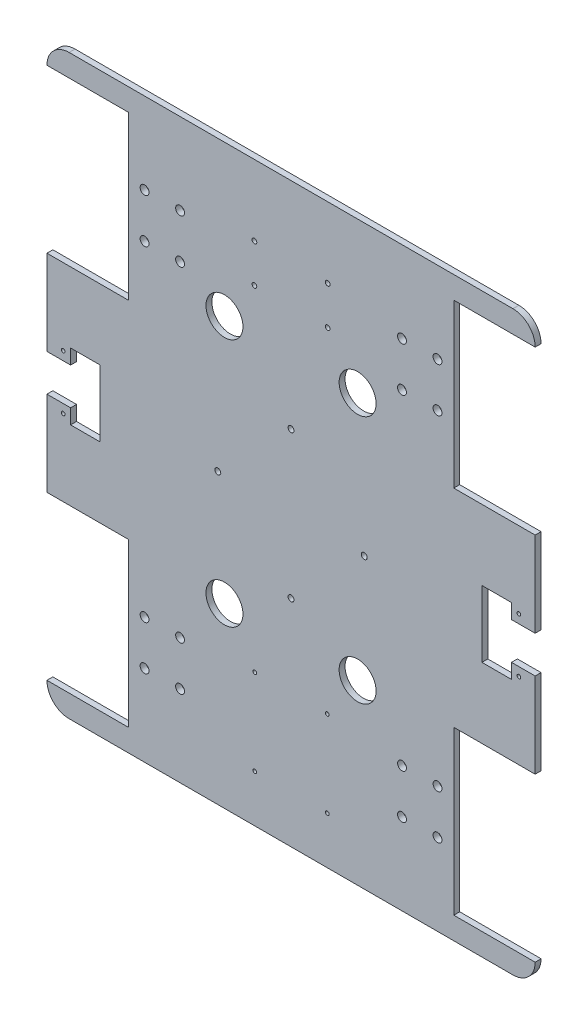
from build123d import *

# Parameters (mm, degrees)
SKETCH_1_W          = 330
SKETCH_1_H          = 390
EXTRUDE_1_DEPTH     = 4
SKETCH_3_W          = 110
SKETCH_3_H          = 110
CUT_EXTRUDE_1_DEPTH = 4
SKETCH_5_R          = 1.25
CUT_EXTRUDE_2_DEPTH = 4
SKETCH_7_R          = 2
CUT_EXTRUDE_3_DEPTH = 4
SKETCH_8_R          = 1.6
CUT_EXTRUDE_4_DEPTH = 4
SKETCH_9_R          = 3
CUT_EXTRUDE_5_DEPTH = 4
SKETCH_11_R         = 3
CUT_EXTRUDE_6_DEPTH = 4
SKETCH_14_R         = 12.5
CUT_EXTRUDE_7_DEPTH = 4
FILLET_1_R          = 15
SKETCH_15_R         = 1.25
CUT_EXTRUDE_8_DEPTH = 4
CUT_EXTRUDE_9_DEPTH = 4


with BuildPart() as part:
    # 草图1 → 凸台-拉伸1 (new body)
    with BuildSketch(Plane.XY):
        Rectangle(SKETCH_1_W, SKETCH_1_H)
    extrude(amount=EXTRUDE_1_DEPTH)

    # 草图3 → 切除-拉伸1 (cut)
    with BuildSketch(Plane.XY.offset(4)):
        with Locations((165, 125)):
            Rectangle(SKETCH_3_W, SKETCH_3_H)
        with Locations((165, -125)):
            Rectangle(SKETCH_3_W, SKETCH_3_H)
        with Locations((-165, -125)):
            Rectangle(SKETCH_3_W, SKETCH_3_H)
        with Locations((-165, 125)):
            Rectangle(SKETCH_3_W, SKETCH_3_H)
    extrude(amount=-CUT_EXTRUDE_1_DEPTH, mode=Mode.SUBTRACT)

    # 草图5 → 切除-拉伸2 (cut)
    with BuildSketch(Plane.XY.offset(4)):
        with Locations((24.5, -163)):
            Circle(SKETCH_5_R)
        with Locations((24.5, -105)):
            Circle(SKETCH_5_R)
        with Locations(Location((-24.5, -105, 0), (0, 0, 180))):
            Circle(SKETCH_5_R)
        with Locations(Location((-24.5, -163, 0), (0, 0, 180))):
            Circle(SKETCH_5_R)
    extrude(amount=-CUT_EXTRUDE_2_DEPTH, mode=Mode.SUBTRACT)

    # 草图7 → 切除-拉伸3 (cut)
    with BuildSketch(Plane.XY.offset(4)):
        with Locations((49.493881146, 0)):
            Circle(SKETCH_7_R)
        with Locations((-49.501067959, 0.007186813)):
            Circle(SKETCH_7_R)
        with Locations((0, 49.501067959)):
            Circle(SKETCH_7_R)
        with Locations((-0.007186813, -49.493881146)):
            Circle(SKETCH_7_R)
    extrude(amount=-CUT_EXTRUDE_3_DEPTH, mode=Mode.SUBTRACT)

    # 草图8 → 切除-拉伸4 (cut)
    with BuildSketch(Plane.XY.offset(4)):
        with Locations((24.75, 121.25952533)):
            Circle(SKETCH_8_R)
        with Locations((24.75, 147.25952533)):
            Circle(SKETCH_8_R)
        with Locations(Location((-24.75, 147.25952533, 0), (0, 0, 180))):
            Circle(SKETCH_8_R)
        with Locations(Location((-24.75, 121.25952533, 0), (0, 0, 180))):
            Circle(SKETCH_8_R)
    extrude(amount=-CUT_EXTRUDE_4_DEPTH, mode=Mode.SUBTRACT)

    # 草图9 → 切除-拉伸5 (cut)
    with BuildSketch(Plane.XY.offset(4)):
        with Locations((99, -140)):
            Circle(SKETCH_9_R)
        with Locations((75, -140)):
            Circle(SKETCH_9_R)
        with Locations(Location((99, -110, 0), (0, 0, 180))):
            Circle(SKETCH_9_R)
        with Locations(Location((75, -110, 0), (0, 0, 180))):
            Circle(SKETCH_9_R)
        with Locations((-99, -110)):
            Circle(SKETCH_9_R)
        with Locations((-75, -110)):
            Circle(SKETCH_9_R)
        with Locations(Location((-99, -140, 0), (0, 0, 180))):
            Circle(SKETCH_9_R)
        with Locations(Location((-75, -140, 0), (0, 0, 180))):
            Circle(SKETCH_9_R)
    extrude(amount=-CUT_EXTRUDE_5_DEPTH, mode=Mode.SUBTRACT)

    # 草图11 → 切除-拉伸6 (cut)
    with BuildSketch(Plane.XY.offset(4)):
        with Locations((99, 140)):
            Circle(SKETCH_11_R)
        with Locations((99, 110)):
            Circle(SKETCH_11_R)
        with Locations((75, 110)):
            Circle(SKETCH_11_R)
        with Locations((75, 140)):
            Circle(SKETCH_11_R)
        with Locations(Location((-75, 110, 0), (0, 0, 180))):
            Circle(SKETCH_11_R)
        with Locations(Location((-99, 110, 0), (0, 0, 180))):
            Circle(SKETCH_11_R)
        with Locations(Location((-99, 140, 0), (0, 0, 180))):
            Circle(SKETCH_11_R)
        with Locations(Location((-75, 140, 0), (0, 0, 180))):
            Circle(SKETCH_11_R)
    extrude(amount=-CUT_EXTRUDE_6_DEPTH, mode=Mode.SUBTRACT)

    # 草图14 → 切除-拉伸7 (cut)
    with BuildSketch(Plane.XY.offset(4)):
        with Locations((45, 93.171201499)):
            Circle(SKETCH_14_R)
        with Locations((45, -75.052125949)):
            Circle(SKETCH_14_R)
        with Locations(Location((-45, -75.052125949, 0), (0, 0, 180))):
            Circle(SKETCH_14_R)
        with Locations(Location((-45, 93.171201499, 0), (0, 0, 180))):
            Circle(SKETCH_14_R)
    extrude(amount=-CUT_EXTRUDE_7_DEPTH, mode=Mode.SUBTRACT)

    # 圆角1
    fillet_1_edges = [part.edges().sort_by_distance(p)[0] for p in [
        (165, -195, 2),
        (-165, -195, 2),
        (165, 195, 2),
        (-165, 195, 2),
    ]]
    fillet(fillet_1_edges, radius=FILLET_1_R - 0.0001)  # a hair under: the kernel refuses the full size

    # 草图15 → 切除-拉伸8 (cut)
    with BuildSketch(Plane.XY.offset(4)):
        with Locations((154, 18.45)):
            Circle(SKETCH_15_R)
        with Locations((154, -18.342402047)):
            Circle(SKETCH_15_R)
    cut_extrude_8 = extrude(amount=-CUT_EXTRUDE_8_DEPTH, mode=Mode.SUBTRACT)

    # 草图16 → 切除-拉伸9 (cut)
    with BuildSketch(Plane.XY.offset(4)):
        Polygon((165, -12.5), (165, 12.5), (149, 12.5), (149, 22.5), (129, 22.5), (129, -22.5), (149, -22.5), (149, -12.5), align=None)
    cut_extrude_9 = extrude(amount=-CUT_EXTRUDE_9_DEPTH, mode=Mode.SUBTRACT)

    # 镜向1: 切除-拉伸8, 切除-拉伸9 across plane
    add(cut_extrude_8.mirror(Plane(origin=(0, 0, 0), x_dir=(0, 0, 1), z_dir=(1, 0, 0))), mode=Mode.SUBTRACT)
    add(cut_extrude_9.mirror(Plane(origin=(0, 0, 0), x_dir=(0, 0, 1), z_dir=(1, 0, 0))), mode=Mode.SUBTRACT)


solid = part.part
